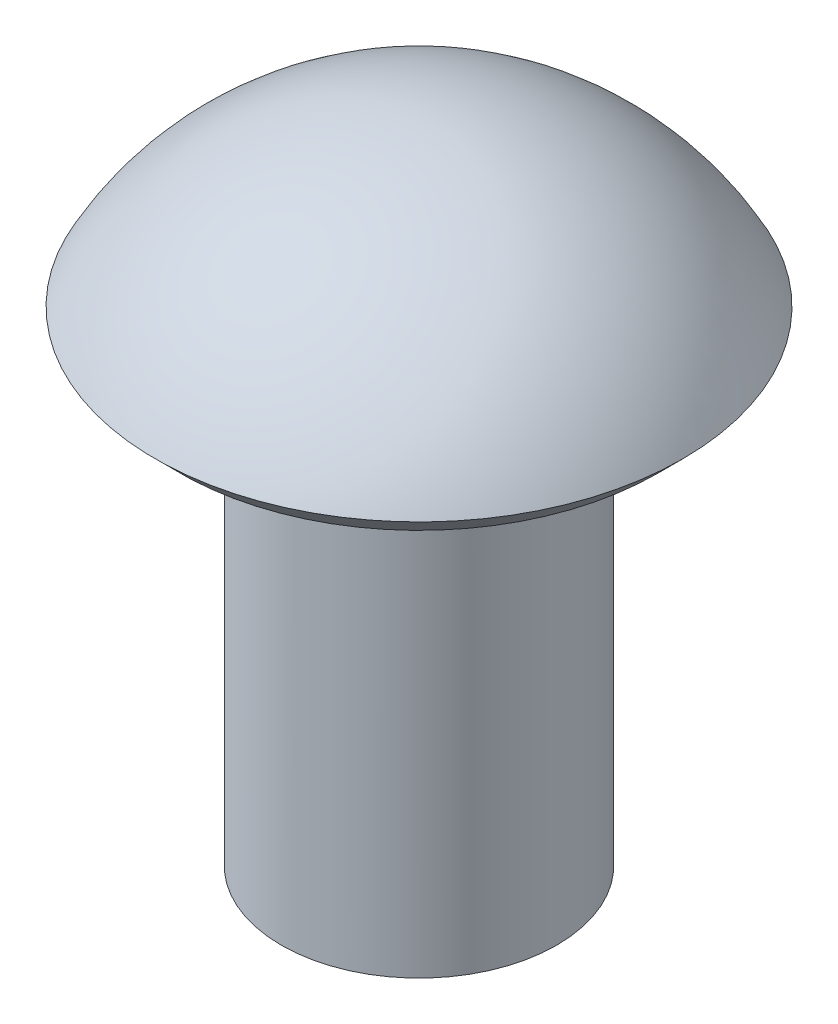
from build123d import *

# Parameters (mm, degrees)
SKETCH1_R           = 1.5
BOSS_EXTRUDE1_DEPTH = 5
FILLET2_R           = 0.4
CHAMFER1_SIZE       = 0.4


with BuildPart() as part:
    # Sketch1 → Boss-Extrude1 (new body)
    with BuildSketch(Plane(origin=(0, 0, 0), x_dir=(1, 0, 0), z_dir=(0, 1, 0))):
        with Locations(Location((0, 0, 0), (0, 0, 270))):
            Circle(SKETCH1_R)
    extrude(amount=BOSS_EXTRUDE1_DEPTH)

    # Sketch3 → Revolve1 (revolve)
    with BuildSketch(Plane.XY):
        with BuildLine():
            Line((0, 5), (-3, 5))
            ThreePointArc((-3, 5), (-1.802775638, 6.454163457), (0, 7))
            Line((0, 7), (0, 5))
        make_face()
    revolve(axis=Axis((0, 7, 0), (0, -1, 0)))

    # Fillet2
    fillet2_edges = [part.edges().sort_by_distance(p)[0] for p in [
        (0, 5, -1.5),
    ]]
    fillet(fillet2_edges, radius=FILLET2_R)

    # Chamfer1
    # the kernel refuses this chamfer: 0.4, 0.305882353 mm, written as the material it takes off along each edge
    with BuildSketch(Plane(origin=(0, 5, 0), x_dir=(-1, 0, 0), z_dir=(0, 0, 1))) as chamfer1_piece_1:
        with BuildLine():
            Line((3 - CHAMFER1_SIZE, 0), (2.871730525, -0.271730525))
            ThreePointArc((2.871730525, -0.271730525), (2.93785488, -0.139787287), (3, 0))
            Line((3, 0), (3 - CHAMFER1_SIZE, 0))
        make_face()
    revolve(axis=Axis((0, 5, 0), (0, -1, 0)), mode=Mode.SUBTRACT)


solid = part.part
